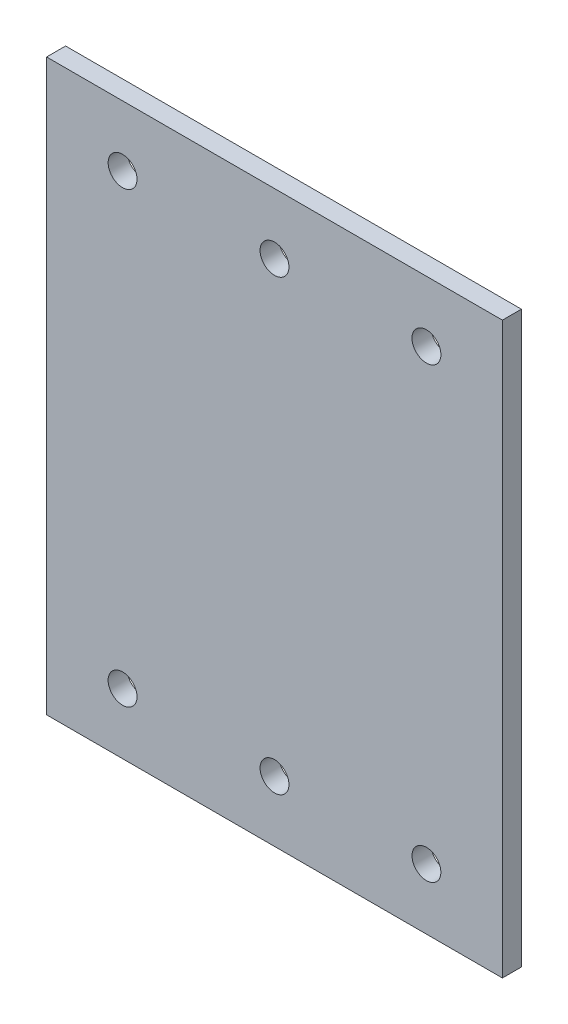
from build123d import *

# Parameters (mm, degrees)
SKETCH1_W           = 76.2
SKETCH1_H           = 95.25
SKETCH1_R           = 2.413
BOSS_EXTRUDE1_DEPTH = 3.175


with BuildPart() as part:
    # Sketch1 → Boss-Extrude1 (new body)
    with BuildSketch(Plane.XY):
        with Locations((38.1, 47.625)):
            Rectangle(SKETCH1_W, SKETCH1_H)
        with Locations((12.7, 85.09)):
            Circle(SKETCH1_R, mode=Mode.SUBTRACT)
        with Locations((38.1, 85.09)):
            Circle(SKETCH1_R, mode=Mode.SUBTRACT)
        with Locations((63.5, 85.09)):
            Circle(SKETCH1_R, mode=Mode.SUBTRACT)
        with Locations((63.5, 10.16)):
            Circle(SKETCH1_R, mode=Mode.SUBTRACT)
        with Locations((38.1, 10.16)):
            Circle(SKETCH1_R, mode=Mode.SUBTRACT)
        with Locations((12.7, 10.16)):
            Circle(SKETCH1_R, mode=Mode.SUBTRACT)
    extrude(amount=BOSS_EXTRUDE1_DEPTH)


solid = part.part
